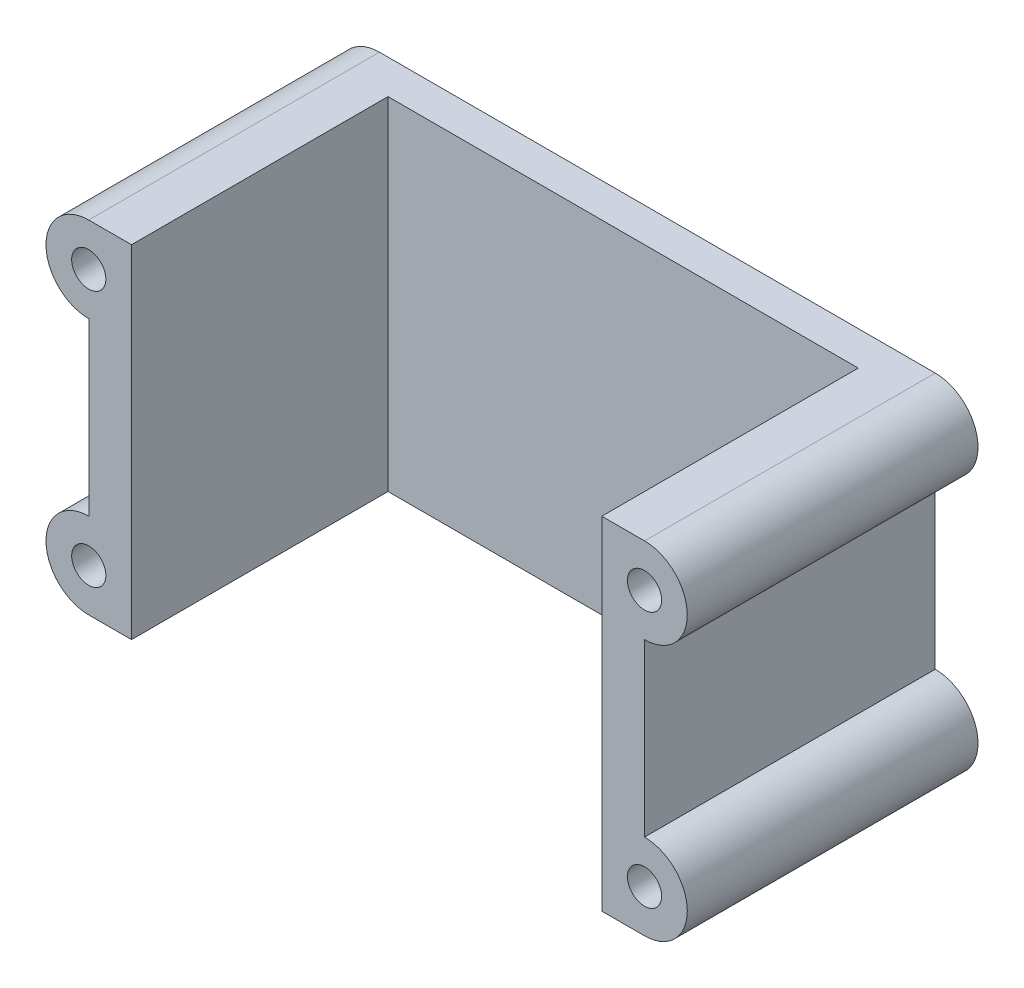
from build123d import *

# Parameters (mm, degrees)
SKETCH1_W                                  = 65
SKETCH1_H                                  = 40
BOSS_EXTRUDE1_DEPTH                        = 4
SKETCH2_W                                  = 5
SKETCH2_H                                  = 40
BOSS_EXTRUDE2_DEPTH                        = 30
BOSS_EXTRUDE3_DEPTH                        = 34
SKETCH5_R                                  = 2
CUT_EXTRUDE1_DEPTH                         = 34
MIRROR1_AT_THE_SECOND_PLANE_COPY_1_DEPTH   = 34
MIRROR1_AT_THE_SECOND_PLANE_COPY_2_SKETC_R = 2
MIRROR1_AT_THE_SECOND_PLANE_COPY_2_DEPTH   = 34


with BuildPart() as part:
    # Sketch1 → Boss-Extrude1 (new body)
    with BuildSketch(Plane.XY):
        Rectangle(SKETCH1_W, SKETCH1_H)
    extrude(amount=BOSS_EXTRUDE1_DEPTH)

    # Sketch2 → Boss-Extrude2 (add)
    with BuildSketch(Plane.XY.offset(4)):
        with Locations((-30, 0)):
            Rectangle(SKETCH2_W, SKETCH2_H)
        with Locations((30, 0)):
            Rectangle(SKETCH2_W, SKETCH2_H)
    extrude(amount=BOSS_EXTRUDE2_DEPTH)

    # Sketch3 → Boss-Extrude3 (add)
    with BuildSketch(Plane.XY):
        with BuildLine():
            Line((-32.5, 20), (-32.5, 10))
            ThreePointArc((-32.5, 10), (-37.5, 15), (-32.5, 20))
        make_face()
    boss_extrude3 = extrude(amount=BOSS_EXTRUDE3_DEPTH)

    # Sketch5 → Cut-Extrude1 (cut)
    with BuildSketch(Plane.XY.offset(34)):
        with Locations((-32.5, 15)):
            Circle(SKETCH5_R)
    cut_extrude1 = extrude(amount=-CUT_EXTRUDE1_DEPTH, mode=Mode.SUBTRACT)

    # Mirror1: Boss-Extrude3, Cut-Extrude1 across plane
    add(boss_extrude3.mirror(Plane(origin=(0, 0, 0), x_dir=(0, 0, 1), z_dir=(1, 0, 0))))
    add(cut_extrude1.mirror(Plane(origin=(0, 0, 0), x_dir=(0, 0, 1), z_dir=(1, 0, 0))), mode=Mode.SUBTRACT)

    # Mirror1 at the second plane: Boss-Extrude3, Cut-Extrude1 across plane
    add(boss_extrude3.mirror(Plane.ZX))
    add(cut_extrude1.mirror(Plane.ZX), mode=Mode.SUBTRACT)

    # Mirror1 at the second plane copy 1 sketc → Mirror1 at the second plane copy 1 (add)
    with BuildSketch(Plane(origin=(0, 0, 0), x_dir=(-1, 0, 0), z_dir=(0, 0, 1))):
        with BuildLine():
            Line((-32.5, 20), (-32.5, 10))
            ThreePointArc((-32.5, 10), (-37.5, 15), (-32.5, 20))
        make_face()
    extrude(amount=MIRROR1_AT_THE_SECOND_PLANE_COPY_1_DEPTH)

    # Mirror1 at the second plane copy 2 sketc → Mirror1 at the second plane copy 2 (cut)
    with BuildSketch(Plane(origin=(0, 0, 34), x_dir=(-1, 0, 0), z_dir=(0, 0, 1))):
        with Locations((-32.5, 15)):
            Circle(MIRROR1_AT_THE_SECOND_PLANE_COPY_2_SKETC_R)
    extrude(amount=-MIRROR1_AT_THE_SECOND_PLANE_COPY_2_DEPTH, mode=Mode.SUBTRACT)


solid = part.part
